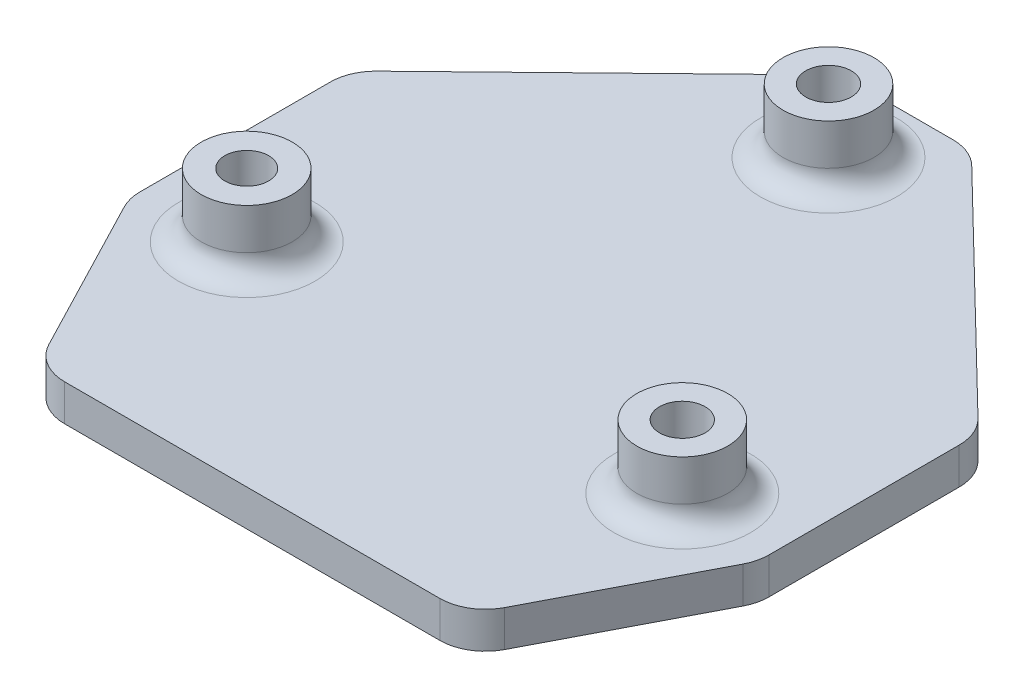
from build123d import *

# Parameters (mm, degrees)
SKETCH1_R           = 2.5
BOSS_EXTRUDE2_DEPTH = 4
FILLET1_R           = 5
SKETCH2_R           = 5
SKETCH2_R_2         = 2.5
SKETCH2_R_3         = 2.410622894
BOSS_EXTRUDE3_DEPTH = 7
FILLET2_R           = 2.5


with BuildPart() as part:
    # Sketch1 → Boss-Extrude2 (new body)
    with BuildSketch(Plane(origin=(0, 0, 0), x_dir=(1, 0, 0), z_dir=(0, 1, 0))):
        Polygon((-2.997842525, 1.627546264), (-2.997842525, -22.606832334), (7.911575214, -43.612950039), (31.557320362, -43.612950039), (55.203065509, -43.612950039), (66.112483248, -22.606832334), (66.112483248, 1.627546264), (38.728999177, 28.237162663), (24.385641546, 28.237162663), align=None)
        with Locations((55.490124242, -20.289109104)):
            Circle(SKETCH1_R, mode=Mode.SUBTRACT)
        with Locations((31.557320362, 19.710890896)):
            Circle(SKETCH1_R, mode=Mode.SUBTRACT)
        with Locations((7.624516482, -20.289109104)):
            Circle(SKETCH1_R, mode=Mode.SUBTRACT)
    extrude(amount=BOSS_EXTRUDE2_DEPTH)

    # Fillet1
    fillet1_edges = [part.edges().sort_by_distance(p)[0] for p in [
        (7.911575214, 2, 43.612950039),
        (55.203065509, 2, 43.612950039),
        (66.112483248, 2, 22.606832334),
        (66.112483248, 2, -1.627546264),
        (-2.997842525, 2, -1.627546264),
        (-2.997842525, 2, 22.606832334),
        (24.385641546, 2, -28.237162663),
        (38.728999177, 2, -28.237162663),
    ]]
    fillet(fillet1_edges, radius=FILLET1_R)

    # Sketch2 → Boss-Extrude3 (add)
    # profile 1 of 3: a face of its own
    with BuildSketch(Plane(origin=(0, 4, 0), x_dir=(1, 0, 0), z_dir=(0, 1, 0))):
        with Locations((31.557320362, 19.710890896)):
            Circle(SKETCH2_R)
        with Locations((31.557320362, 19.710890896)):
            Circle(SKETCH2_R_2, mode=Mode.SUBTRACT)
    # profile 2 of 3: a face of its own
    with BuildSketch(Plane(origin=(0, 4, 0), x_dir=(1, 0, 0), z_dir=(0, 1, 0))):
        with Locations((55.490124242, -20.289109104)):
            Circle(SKETCH2_R)
        with Locations((55.490124242, -20.289109104)):
            Circle(SKETCH2_R_2, mode=Mode.SUBTRACT)
    # profile 3 of 3: a face of its own
    with BuildSketch(Plane(origin=(0, 4, 0), x_dir=(1, 0, 0), z_dir=(0, 1, 0))):
        with Locations((7.624516482, -20.289109104)):
            Circle(SKETCH2_R)
        with Locations((7.624516482, -20.289109104)):
            Circle(SKETCH2_R_3, mode=Mode.SUBTRACT)
    extrude(amount=BOSS_EXTRUDE3_DEPTH)

    # Fillet2
    fillet2_edges = [part.edges().sort_by_distance(p)[0] for p in [
        (50.490124242, 4, 20.289109104),
        (2.624516482, 4, 20.289109104),
        (26.557320362, 4, -19.710890896),
    ]]
    fillet(fillet2_edges, radius=FILLET2_R)


solid = part.part
